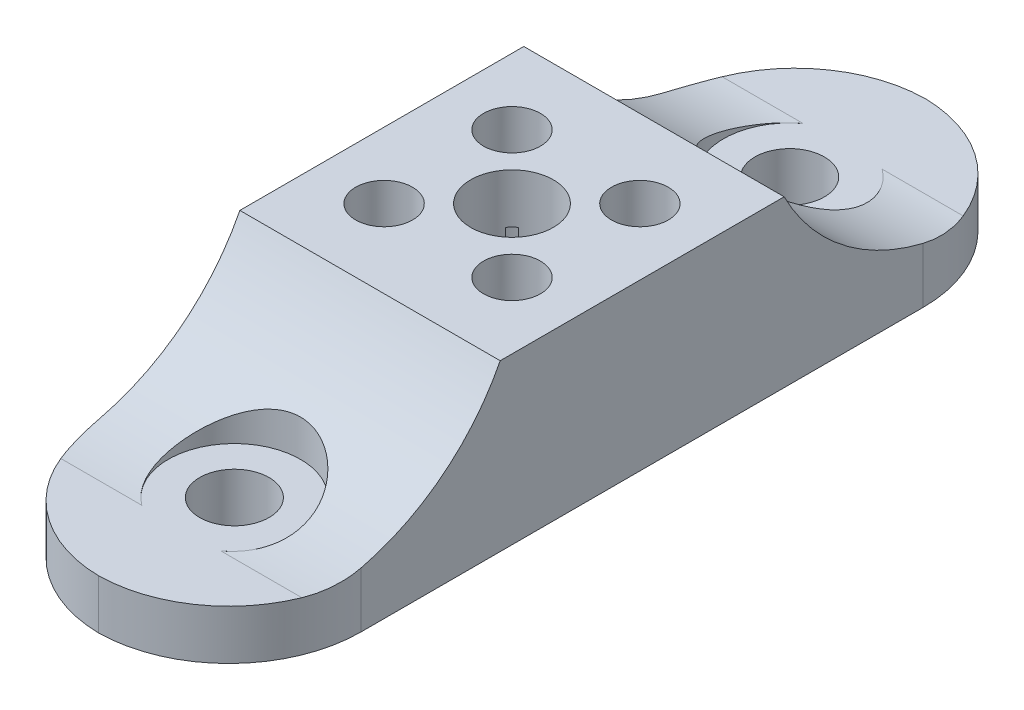
from build123d import *

# Parameters (mm, degrees)
SKETCH1_W               = 20
SKETCH1_H               = 63.5
BOSS_EXTRUDE1_DEPTH     = 12.7
SKETCH2_R               = 3.175
SKETCH2_R_2             = 2.1844
CUT_EXTRUDE1_DEPTH      = 36.62797356
CUT_EXTRUDE2_DEPTH      = 36.62797356
CUT_EXTRUDE2_DEPTH_BACK = 36.62797356
SKETCH4_R               = 3.81
CUT_EXTRUDE3_DEPTH      = 8.89
SKETCH4_3_R             = 3.81
SKETCH4_3_R_2           = 2.1844
SKETCH4_3_R_3           = 5.334
SKETCH4_3_R_4           = 3.175
CUT_EXTRUDE4_DEPTH      = 3.81
SKETCH6_R               = 5.08
SKETCH6_R_2             = 2.667
CUT_EXTRUDE5_DEPTH      = 8.89
SKETCH6_4_R             = 2.667
CUT_EXTRUDE6_DEPTH      = 35.454239272
FILLET1_R               = 10.16


with BuildPart() as part:
    # Sketch1 → Boss-Extrude1 (new body)
    with BuildSketch(Plane(origin=(0, 0, 0), x_dir=(1, 0, 0), z_dir=(0, 1, 0))):
        Rectangle(SKETCH1_W, SKETCH1_H)
    extrude(amount=BOSS_EXTRUDE1_DEPTH)

    # Sketch2 → Cut-Extrude1 (cut, through all)
    with BuildSketch(Plane(origin=(0, 12.7, 0), x_dir=(1, 0, 0), z_dir=(0, 1, 0))):
        with Locations(Location((0, 0, 0), (0, 0, 270))):
            Circle(SKETCH2_R)
        with Locations(Location((-4.912200098, 4.912200098, 0), (0, 0, 270))):
            Circle(SKETCH2_R_2)
        with Locations(Location((4.912200098, -4.912200098, 0), (0, 0, 270))):
            Circle(SKETCH2_R_2)
        with Locations(Location((4.912200098, 4.912200098, 0), (0, 0, 90))):
            Circle(SKETCH2_R_2)
        with Locations(Location((-4.912200098, -4.912200098, 0), (0, 0, 90))):
            Circle(SKETCH2_R_2)
    extrude(amount=-CUT_EXTRUDE1_DEPTH, mode=Mode.SUBTRACT)

    # Sketch3 → Cut-Extrude2 (cut, two sides: drawn at the far end of the back side and taken through both)
    with BuildSketch(Plane(origin=(0, 0, 0), x_dir=(0, 0, -1), z_dir=(1, 0, 0)).offset(-CUT_EXTRUDE2_DEPTH_BACK)):
        with BuildLine():
            Line((31.75, 3.81), (31.75, 12.7))
            Line((31.75, 12.7), (10.906600098, 12.7))
            ThreePointArc((10.906600098, 12.7), (16.898665682, 6.209564949), (25.4, 3.81))
            Line((25.4, 3.81), (31.75, 3.81))
        make_face()
        with BuildLine():
            ThreePointArc((-25.4, 3.81), (-16.898665682, 6.209564949), (-10.906600098, 12.7))
            Line((-10.906600098, 12.7), (-31.75, 12.7))
            Line((-31.75, 12.7), (-31.75, 3.81))
            Line((-31.75, 3.81), (-25.4, 3.81))
        make_face()
    extrude(amount=CUT_EXTRUDE2_DEPTH + CUT_EXTRUDE2_DEPTH_BACK, mode=Mode.SUBTRACT)

    # Sketch4 → Cut-Extrude3 (cut)
    with BuildSketch(Plane.XZ):
        with Locations((-4.912200098, -4.912200098)):
            Circle(SKETCH4_R)
        with Locations((4.912200098, 4.912200098)):
            Circle(SKETCH4_R)
        with Locations((-4.912200098, 4.912200098)):
            Circle(SKETCH4_R)
        with Locations((4.912200098, -4.912200098)):
            Circle(SKETCH4_R)
    extrude(amount=-CUT_EXTRUDE3_DEPTH, mode=Mode.SUBTRACT)

    # Sketch4<3> → Cut-Extrude4 (cut)
    # profile 1 of 28: a face of its own
    with BuildSketch(Plane.XZ):
        with Locations((-4.912200098, 4.912200098)):
            Circle(SKETCH4_3_R)
        with Locations(Location((-4.912200098, 4.912200098, 0), (0, 0, 270))):
            Circle(SKETCH4_3_R_2, mode=Mode.SUBTRACT)
    # profile 2 of 28: a face of its own
    with BuildSketch(Plane.XZ):
        Circle(SKETCH4_3_R_3)
        with Locations(Location((0, 0, 0), (0, 0, 90))):
            Circle(SKETCH4_3_R_4, mode=Mode.SUBTRACT)
    # profile 3 of 28: a face of its own
    with BuildSketch(Plane.XZ):
        Circle(SKETCH4_3_R_3)
    # profile 4 of 28: a face of its own
    with BuildSketch(Plane.XZ):
        with Locations(Location((-4.912200098, 4.912200098, 0), (0, 0, 270))):
            Circle(SKETCH4_3_R_2)
    # profile 5 of 28: a face of its own
    with BuildSketch(Plane.XZ):
        with Locations((-4.912200098, 4.912200098)):
            Circle(SKETCH4_3_R)
    # profile 6 of 28: a face of its own
    with BuildSketch(Plane.XZ):
        Circle(SKETCH4_3_R_3)
        with Locations(Location((0, 0, 0), (0, 0, 90))):
            Circle(SKETCH4_3_R_4, mode=Mode.SUBTRACT)
    # profile 7 of 28: a face of its own
    with BuildSketch(Plane.XZ):
        with Locations((-4.912200098, -4.912200098)):
            Circle(SKETCH4_3_R)
    # profile 8 of 28: a face of its own
    with BuildSketch(Plane.XZ):
        Circle(SKETCH4_3_R_3)
        with Locations(Location((0, 0, 0), (0, 0, 90))):
            Circle(SKETCH4_3_R_4, mode=Mode.SUBTRACT)
    # profile 9 of 28: a face of its own
    with BuildSketch(Plane.XZ):
        with Locations((-4.912200098, -4.912200098)):
            Circle(SKETCH4_3_R)
        with Locations(Location((-4.912200098, -4.912200098, 0), (0, 0, 90))):
            Circle(SKETCH4_3_R_2, mode=Mode.SUBTRACT)
    # profile 10 of 28: a face of its own
    with BuildSketch(Plane.XZ):
        Circle(SKETCH4_3_R_3)
    # profile 11 of 28: a face of its own
    with BuildSketch(Plane.XZ):
        with Locations(Location((-4.912200098, -4.912200098, 0), (0, 0, 90))):
            Circle(SKETCH4_3_R_2)
    # profile 12 of 28: a face of its own
    with BuildSketch(Plane.XZ):
        with BuildLine():
            ThreePointArc((1.973854475, -2.486870224), (1.04518229, -2.998035854), (0, -3.175))
            Line((0, -3.175), (0, -5.334))
            ThreePointArc((0, -5.334), (0.560277089, -5.304492962), (1.114355409, -5.216298306))
            ThreePointArc((1.114355409, -5.216298306), (1.278123958, -3.767826643), (1.973854475, -2.486870224))
        make_face()
    # profile 13 of 28: a face of its own
    with BuildSketch(Plane.XZ):
        with BuildLine():
            Line((0, -5.334), (0, -3.175))
            ThreePointArc((0, -3.175), (-1.04518229, -2.998035854), (-1.973854475, -2.486870224))
            ThreePointArc((-1.973854475, -2.486870224), (-1.326729639, -3.623595587), (-1.102200098, -4.912200098))
            ThreePointArc((-1.102200098, -4.912200098), (-1.105240139, -5.064370621), (-1.114355409, -5.216298306))
            ThreePointArc((-1.114355409, -5.216298306), (-0.560277089, -5.304492962), (0, -5.334))
        make_face()
    # profile 14 of 28: a face of its own
    with BuildSketch(Plane.XZ):
        with Locations((4.912200098, -4.912200098)):
            Circle(SKETCH4_3_R)
        with Locations(Location((4.912200098, -4.912200098, 0), (0, 0, 270))):
            Circle(SKETCH4_3_R_2, mode=Mode.SUBTRACT)
    # profile 15 of 28: a face of its own
    with BuildSketch(Plane.XZ):
        Circle(SKETCH4_3_R_3)
        with Locations(Location((0, 0, 0), (0, 0, 90))):
            Circle(SKETCH4_3_R_4, mode=Mode.SUBTRACT)
    # profile 16 of 28: a face of its own
    with BuildSketch(Plane.XZ):
        Circle(SKETCH4_3_R_3)
    # profile 17 of 28: a face of its own
    with BuildSketch(Plane.XZ):
        with Locations(Location((4.912200098, -4.912200098, 0), (0, 0, 270))):
            Circle(SKETCH4_3_R_2)
    # profile 18 of 28: a face of its own
    with BuildSketch(Plane.XZ):
        with Locations((4.912200098, -4.912200098)):
            Circle(SKETCH4_3_R)
    # profile 19 of 28: a face of its own
    with BuildSketch(Plane.XZ):
        Circle(SKETCH4_3_R_3)
        with Locations(Location((0, 0, 0), (0, 0, 90))):
            Circle(SKETCH4_3_R_4, mode=Mode.SUBTRACT)
    # profile 20 of 28: a face of its own
    with BuildSketch(Plane.XZ):
        with Locations((4.912200098, 4.912200098)):
            Circle(SKETCH4_3_R)
    # profile 21 of 28: a face of its own
    with BuildSketch(Plane.XZ):
        Circle(SKETCH4_3_R_3)
        with Locations(Location((0, 0, 0), (0, 0, 90))):
            Circle(SKETCH4_3_R_4, mode=Mode.SUBTRACT)
    # profile 22 of 28: a face of its own
    with BuildSketch(Plane.XZ):
        with Locations((4.912200098, 4.912200098)):
            Circle(SKETCH4_3_R)
        with Locations(Location((4.912200098, 4.912200098, 0), (0, 0, 90))):
            Circle(SKETCH4_3_R_2, mode=Mode.SUBTRACT)
    # profile 23 of 28: a face of its own
    with BuildSketch(Plane.XZ):
        Circle(SKETCH4_3_R_3)
    # profile 24 of 28: a face of its own
    with BuildSketch(Plane.XZ):
        with Locations(Location((4.912200098, 4.912200098, 0), (0, 0, 90))):
            Circle(SKETCH4_3_R_2)
    # profile 25 of 28: a face of its own
    with BuildSketch(Plane.XZ):
        with BuildLine():
            Line((0, 3.175), (0, 5.334))
            ThreePointArc((0, 5.334), (-0.560277089, 5.304492962), (-1.114355409, 5.216298306))
            ThreePointArc((-1.114355409, 5.216298306), (-1.105240139, 5.064370621), (-1.102200098, 4.912200098))
            ThreePointArc((-1.102200098, 4.912200098), (-1.326729639, 3.623595587), (-1.973854475, 2.486870224))
            ThreePointArc((-1.973854475, 2.486870224), (-1.04518229, 2.998035854), (0, 3.175))
        make_face()
    # profile 26 of 28: a face of its own
    with BuildSketch(Plane.XZ):
        with BuildLine():
            ThreePointArc((1.114355409, 5.216298306), (0.560277089, 5.304492962), (0, 5.334))
            Line((0, 5.334), (0, 3.175))
            ThreePointArc((0, 3.175), (1.04518229, 2.998035854), (1.973854475, 2.486870224))
            ThreePointArc((1.973854475, 2.486870224), (1.278123958, 3.767826643), (1.114355409, 5.216298306))
        make_face()
    # profile 27 of 28: a face of its own
    with BuildSketch(Plane.XZ):
        with BuildLine():
            ThreePointArc((1.973854475, 2.486870224), (1.04518229, 2.998035854), (0, 3.175))
            Line((0, 3.175), (0, -3.175))
            ThreePointArc((0, -3.175), (1.04518229, -2.998035854), (1.973854475, -2.486870224))
            ThreePointArc((1.973854475, -2.486870224), (2.218123262, -2.218123262), (2.486870224, -1.973854475))
            ThreePointArc((2.486870224, -1.973854475), (2.998035854, -1.04518229), (3.175, 0))
            ThreePointArc((3.175, 0), (2.998035854, 1.04518229), (2.486870224, 1.973854475))
            ThreePointArc((2.486870224, 1.973854475), (2.218123262, 2.218123262), (1.973854475, 2.486870224))
        make_face()
    # profile 28 of 28: a face of its own
    with BuildSketch(Plane.XZ):
        with BuildLine():
            Line((0, -3.175), (0, 3.175))
            ThreePointArc((0, 3.175), (-1.04518229, 2.998035854), (-1.973854475, 2.486870224))
            ThreePointArc((-1.973854475, 2.486870224), (-2.218123262, 2.218123262), (-2.486870224, 1.973854475))
            ThreePointArc((-2.486870224, 1.973854475), (-3.175, 0), (-2.486870224, -1.973854475))
            ThreePointArc((-2.486870224, -1.973854475), (-2.218123262, -2.218123262), (-1.973854475, -2.486870224))
            ThreePointArc((-1.973854475, -2.486870224), (-1.04518229, -2.998035854), (0, -3.175))
        make_face()
    extrude(amount=-CUT_EXTRUDE4_DEPTH, mode=Mode.SUBTRACT)

    # Sketch6 → Cut-Extrude5 (cut)
    # profile 1 of 3: a face of its own
    with BuildSketch(Plane(origin=(0, 3.81, 0), x_dir=(1, 0, 0), z_dir=(0, 1, 0))):
        with Locations((0, -21.328300049)):
            Circle(SKETCH6_R)
        with Locations((0, -21.328300049)):
            Circle(SKETCH6_R_2, mode=Mode.SUBTRACT)
    # profile 2 of 3: a face of its own
    with BuildSketch(Plane(origin=(0, 3.81, 0), x_dir=(1, 0, 0), z_dir=(0, 1, 0))):
        with Locations((0, -21.328300049)):
            Circle(SKETCH6_R_2)
    # profile 3 of 3: a face of its own
    with BuildSketch(Plane(origin=(0, 3.81, 0), x_dir=(1, 0, 0), z_dir=(0, 1, 0))):
        with Locations((0, 21.328300049)):
            Circle(SKETCH6_R)
    extrude(amount=CUT_EXTRUDE5_DEPTH, mode=Mode.SUBTRACT)

    # Sketch6<4> → Cut-Extrude6 (cut, through all)
    with BuildSketch(Plane(origin=(0, 3.81, 0), x_dir=(1, 0, 0), z_dir=(0, 1, 0))):
        with Locations(Location((0, 21.328300049, 0), (0, 0, 270))):
            Circle(SKETCH6_4_R)
        with Locations(Location((0, -21.328300049, 0), (0, 0, 270))):
            Circle(SKETCH6_4_R)
    extrude(amount=-CUT_EXTRUDE6_DEPTH, mode=Mode.SUBTRACT)

    # Fillet1
    # the kernel refuses this fillet: 10.16 mm, written as the material it takes off along each edge
    with BuildSketch(Plane(origin=(10, -25.4, 31.75), x_dir=(0, 0, -1), z_dir=(0, 1, 0)), Plane(origin=(10, -25.4, -31.75), x_dir=(-1, 0, 0), z_dir=(0, 1, 0))) as fillet1_piece_1:
        with BuildLine():
            CenterArc((FILLET1_R, FILLET1_R), FILLET1_R, 180, 90)
            Line((0, FILLET1_R), (0, 0))
            Line((0, 0), (FILLET1_R, 0))
        make_face()
    extrude(amount=54.61, mode=Mode.SUBTRACT)
    with BuildSketch(Plane(origin=(-10, -25.4, 31.75), x_dir=(0, 0, -1), z_dir=(0, 1, 0)), Plane(origin=(-10, -25.4, -31.75), x_dir=(1, 0, 0), z_dir=(0, 1, 0))) as fillet1_piece_2:
        with BuildLine():
            CenterArc((FILLET1_R, -FILLET1_R), FILLET1_R, 90, 90)
            Line((0, -FILLET1_R), (0, 0))
            Line((0, 0), (FILLET1_R, 0))
        make_face()
    extrude(amount=54.61, mode=Mode.SUBTRACT)


solid = part.part
